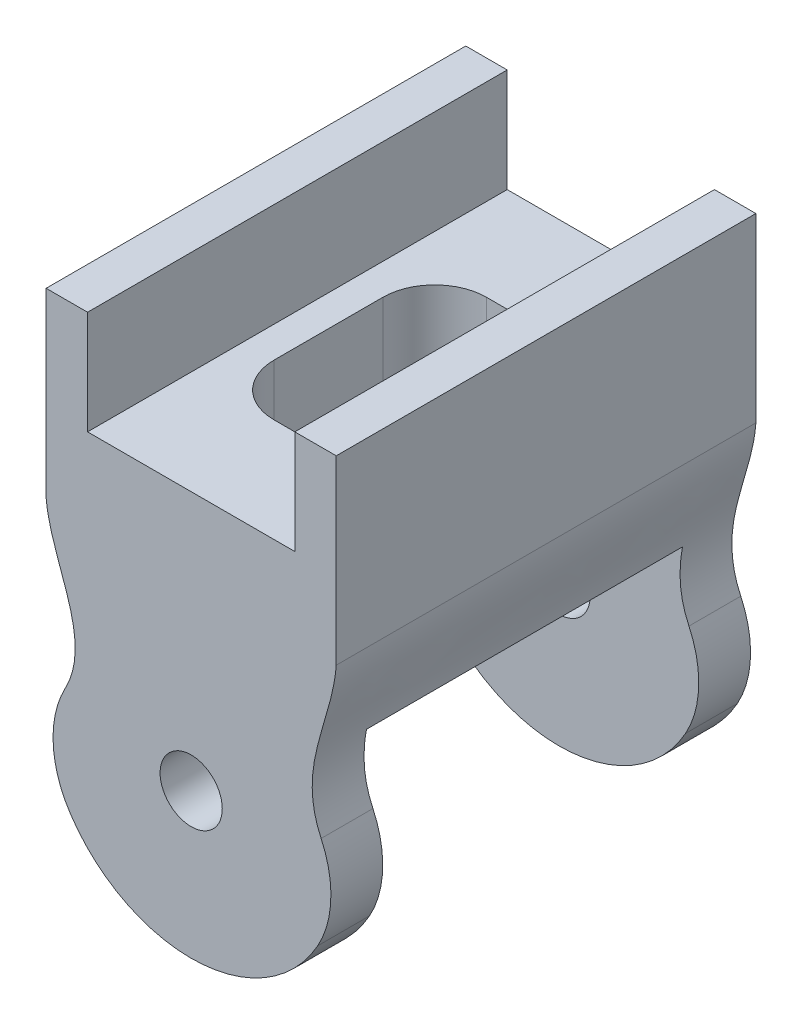
from build123d import *

# Parameters (mm, degrees)
ESQUISSE1_R             = 3
BOSS_EXTRU_1_DEPTH      = 40.5
ESQUISSE2_W             = 30.5
ESQUISSE2_H             = 25
ENL_V_MAT_EXTRU_1_DEPTH = 70.464019463
ESQUISSE3_W             = 20
ESQUISSE3_H             = 40.5
ENL_V_MAT_EXTRU_2_DEPTH = 10
ENL_V_MAT_EXTRU_3_DEPTH = 58.941781126
ENL_V_MAT_EXTRU_4_DEPTH = 66.094162565
CONG_1_R                = 10


with BuildPart() as part:
    # Esquisse1 → Boss.-Extru.1 (new body)
    with BuildSketch(Plane.XY):
        with BuildLine():
            Line((-14, 0), (-14, -35))
            ThreePointArc((-14, -35), (0, -49), (14, -35))
            Line((14, -35), (14, 0))
            Line((14, 0), (-14, 0))
        make_face()
        with Locations((0, -35)):
            Circle(ESQUISSE1_R, mode=Mode.SUBTRACT)
    extrude(amount=BOSS_EXTRU_1_DEPTH)

    # Esquisse2 → Enlèv. mat.-Extru.1 (cut, through all)
    with BuildSketch(Plane.ZY.offset(14)):
        with Locations((20.25, -38.901873341)):
            Rectangle(ESQUISSE2_W, ESQUISSE2_H)
    extrude(amount=-ENL_V_MAT_EXTRU_1_DEPTH, mode=Mode.SUBTRACT)

    # Esquisse3 → Enlèv. mat.-Extru.2 (cut)
    with BuildSketch(Plane(origin=(0, 0, 0), x_dir=(1, 0, 0), z_dir=(0, 1, 0))):
        with Locations((0, -20.25)):
            Rectangle(ESQUISSE3_W, ESQUISSE3_H)
    extrude(amount=-ENL_V_MAT_EXTRU_2_DEPTH, mode=Mode.SUBTRACT)

    # Esquisse4 → Enlèv. mat.-Extru.3 (cut, through all)
    with BuildSketch(Plane(origin=(0, -10, 0), x_dir=(1, 0, 0), z_dir=(0, 1, 0))):
        with BuildLine():
            Line((2, -30.5), (-2, -30.5))
            ThreePointArc((-2, -30.5), (-5.535533906, -29.035533906), (-7, -25.5))
            Line((-7, -25.5), (-7, -15))
            ThreePointArc((-7, -15), (-5.535533906, -11.464466094), (-2, -10))
            Line((-2, -10), (2, -10))
            ThreePointArc((2, -10), (5.535533906, -11.464466094), (7, -15))
            Line((7, -15), (7, -25.5))
            ThreePointArc((7, -25.5), (5.535533906, -29.035533906), (2, -30.5))
        make_face()
    extrude(amount=-ENL_V_MAT_EXTRU_3_DEPTH, mode=Mode.SUBTRACT)

    # Esquisse5 → Enlèv. mat.-Extru.4 (cut, through all)
    with BuildSketch(Plane.XY.offset(40.5)):
        with BuildLine():
            Line((14, -35), (14, -17.5))
            add(Edge.make_bspline(
                [(14, -35), (9.002822981, -28.86173295), (13.570436253, -23.395197627), (14, -17.5)],
                knots=[0, 0, 0, 0, 0.914038717, 0.914038717, 0.914038717, 0.914038717], degree=3))
        make_face()
        with BuildLine():
            Line((-14, -17.5), (-14, -35))
            add(Edge.make_bspline(
                [(-14, -35), (-7.955250537, -28.65811635), (-13.482344512, -23.398478108), (-14, -17.5)],
                knots=[0, 0, 0, 0, 0.914362788, 0.914362788, 0.914362788, 0.914362788], degree=3))
        make_face()
    extrude(amount=-ENL_V_MAT_EXTRU_4_DEPTH, mode=Mode.SUBTRACT)

    # Congé1
    cong_1_edges = [part.edges().sort_by_distance(p)[0] for p in [
        (-14, -35, 38),
        (-14, -35, 2.5),
        (14, -35, 38),
        (14, -35, 2.5),
    ]]
    fillet(cong_1_edges, radius=CONG_1_R)


solid = part.part
